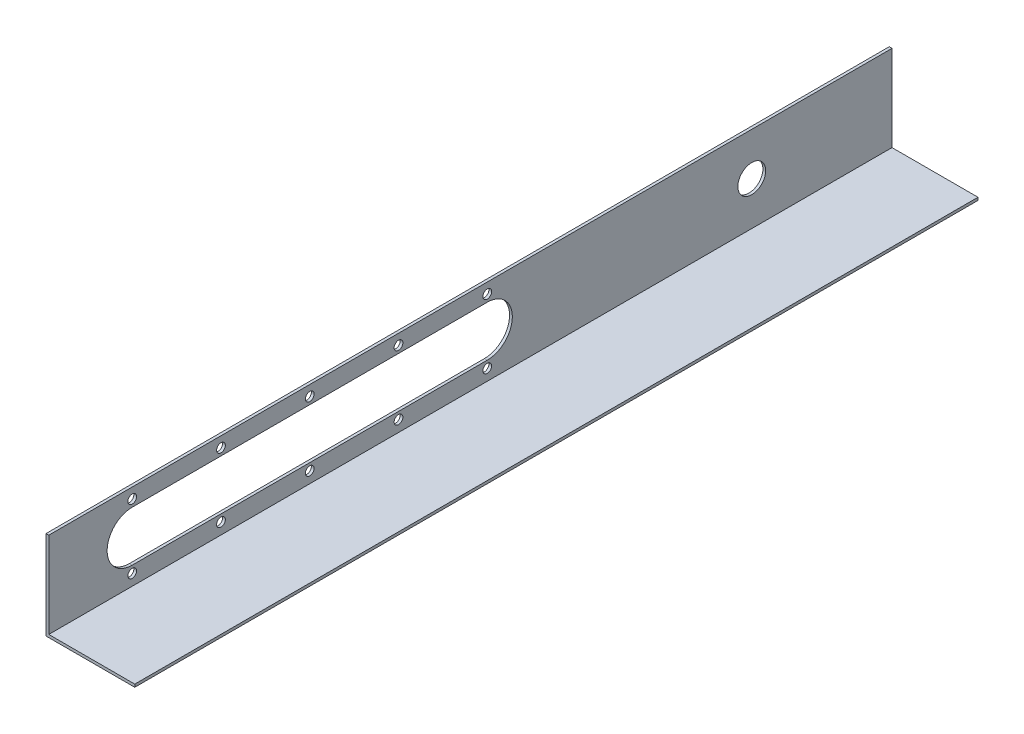
from build123d import *

# Parameters (mm, degrees)
BOSS_EXTRUDE2_DEPTH          = 482.6
CUT_EXTRUDE3_DEPTH           = 488.592555637
SKETCH7_R                    = 7.9629
CUT_EXTRUDE4_DEPTH           = 488.592555637
F_10_0_1935_DIAMETER_HOLE1_D = 4.999999906


with BuildPart() as part:
    # Sketch3 → Boss-Extrude2 (new body)
    with BuildSketch(Plane.XY):
        Polygon((0, 0), (0, 49.2125), (-1.5875, 49.2125), (-1.5875, -1.5875), (49.2125, -1.5875), (49.2125, 0), align=None)
    extrude(amount=BOSS_EXTRUDE2_DEPTH)

    # Sketch6 → Cut-Extrude3 (cut, through all)
    with BuildSketch(Plane(origin=(0, 0, 0), x_dir=(0, 0, -1), z_dir=(1, 0, 0))):
        with BuildLine():
            Line((-434.848, 39.1795), (-231.648, 39.1795))
            ThreePointArc((-231.648, 39.1795), (-217.297, 24.8285), (-231.648, 10.4775))
            Line((-231.648, 10.4775), (-434.848, 10.4775))
            ThreePointArc((-434.848, 10.4775), (-449.199, 24.8285), (-434.848, 39.1795))
        make_face()
    extrude(amount=-CUT_EXTRUDE3_DEPTH, mode=Mode.SUBTRACT)

    # Sketch7 → Cut-Extrude4 (cut, through all)
    with BuildSketch(Plane(origin=(0, 0, 0), x_dir=(0, 0, -1), z_dir=(1, 0, 0))):
        with Locations((-80.264, 24.773594829)):
            Circle(SKETCH7_R)
    extrude(amount=-CUT_EXTRUDE4_DEPTH, mode=Mode.SUBTRACT)

    # #10 (0.1935) Diameter Hole1 (through all)
    with Locations(Plane(origin=(0, 0, 0), x_dir=(0, 0, -1), z_dir=(1, 0, 0))):
        with Locations((-434.848, 43.2435), (-384.048, 43.2435), (-333.248, 43.2435), (-282.448, 43.2435), (-231.648, 43.2435), (-231.648, 6.4135), (-282.448, 6.4135), (-333.248, 6.4135), (-384.048, 6.4135), (-434.848, 6.4135)):
            Hole(F_10_0_1935_DIAMETER_HOLE1_D / 2)


solid = part.part
